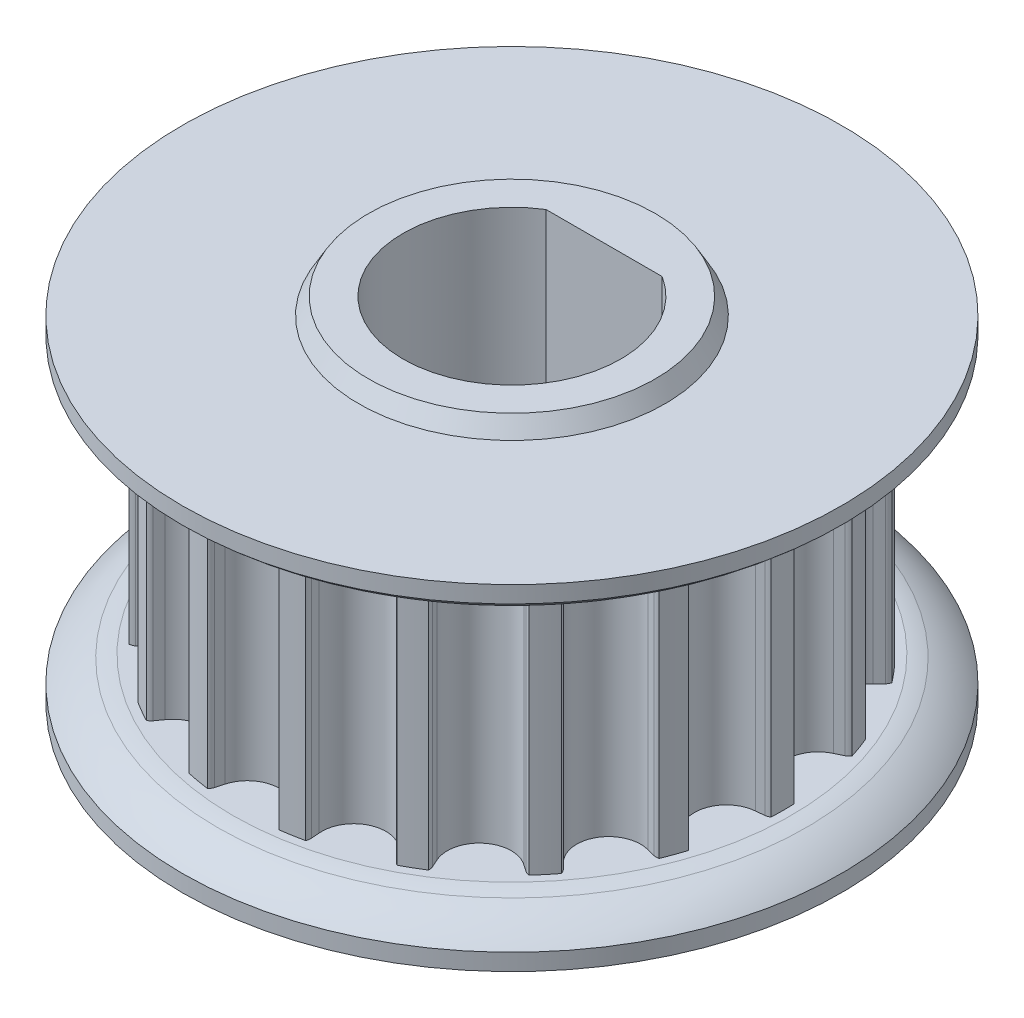
from build123d import *

# Parameters (mm, degrees)
SKETCH1_R           = 8.213367202
TOOTHOD_DEPTH       = 3.81
TOOTHPROFILE_DEPTH  = 13.224356899
TOOTHPATTERN_COUNT  = 18
SKETCH6_W           = 5.08
SKETCH6_H           = 0.508
BORE_DEPTH          = 16.194755053
BORE_DEPTH_BACK     = 16.194755053
SKETCH7_R           = 3.302
BOSS_EXTRUDE2_DEPTH = 7.747
CHAMFER1_SIZE       = 1.27
CHAMFER1_SIZE_2     = 0.733234842


with BuildPart() as part:
    # Sketch1 → ToothOD (new, symmetric)
    with BuildSketch(Plane(origin=(0, 0, 0), x_dir=(1, 0, 0), z_dir=(0, 1, 0))):
        with Locations(Location((0, 0, 0), (0, 0, 90))):
            Circle(SKETCH1_R)
    extrude(amount=TOOTHOD_DEPTH, both=True)

    # Sketch2 → ToothProfile (cut, symmetric)
    with BuildSketch(Plane(origin=(0, 0, 0), x_dir=(1, 0, 0), z_dir=(0, 1, 0))):
        with BuildLine():
            ThreePointArc((-0.937033068, 7.763429198), (-0.590385173, 7.245254588), (0, 7.044967202))
            ThreePointArc((0, 7.044967202), (0.590385173, 7.245254588), (0.937033068, 7.763429198))
            ThreePointArc((0.937033068, 7.763429198), (0.971699064, 7.88954066), (1.007805813, 8.015247202))
            ThreePointArc((1.007805813, 8.015247202), (1.037242296, 8.083128985), (1.082411127, 8.141731201))
            ThreePointArc((1.082411127, 8.141731201), (0, 8.213367202), (-1.082411127, 8.141731201))
            ThreePointArc((-1.082411127, 8.141731201), (-1.037242296, 8.083128985), (-1.007805813, 8.015247202))
            ThreePointArc((-1.007805813, 8.015247202), (-0.971699064, 7.88954066), (-0.937033068, 7.763429198))
        make_face()
    toothprofile = extrude(amount=TOOTHPROFILE_DEPTH, both=True, mode=Mode.SUBTRACT)

    # ToothPattern: ToothProfile ×18 about axis
    toothpattern_axis = Axis((0, 0, 0), (0, 1, 0))
    for i in range(1, TOOTHPATTERN_COUNT):
        add(toothprofile.rotate(toothpattern_axis, i * 360 / TOOTHPATTERN_COUNT), mode=Mode.SUBTRACT)

    # Sketch4 → Flange (revolve)
    with BuildSketch(Plane.XY, mode=Mode.PRIVATE) as flange_sk:
        with BuildLine():
            Line((0, -3.81), (8.467367202, -3.81))
            ThreePointArc((8.467367202, -3.81), (8.697013823, -3.845951298), (8.92243953, -3.902637424))
            ThreePointArc((8.92243953, -3.902637424), (9.490168107, -4.184197125), (9.991367202, -4.572))
            Line((9.991367202, -4.572), (9.991367202, -5.08))
            Line((9.991367202, -5.08), (0, -5.08))
            Line((0, -5.08), (0, -3.81))
        make_face()
        with BuildLine():
            Line((9.991367202, 5.08), (9.991367202, 4.572))
            ThreePointArc((9.991367202, 4.572), (9.490168107, 4.184197125), (8.92243953, 3.902637424))
            ThreePointArc((8.92243953, 3.902637424), (8.697013823, 3.845951298), (8.467367202, 3.81))
            Line((8.467367202, 3.81), (0, 3.81))
            Line((0, 3.81), (0, 5.08))
            Line((0, 5.08), (9.991367202, 5.08))
        make_face()
    revolve(flange_sk.sketch.rotate(Axis((0, 8.73125, 0), (0, -1, 0)), 90), axis=Axis((0, 8.73125, 0), (0, -1, 0)))

    # Sketch6 → TopBearingBoss (revolve)
    with BuildSketch(Plane.XY, mode=Mode.PRIVATE) as topbearingboss_sk:
        with Locations((2.54, 5.334)):
            Rectangle(SKETCH6_W, SKETCH6_H)
    topbearingboss = revolve(topbearingboss_sk.sketch.rotate(Axis((0, 8.73125, 0), (0, -1, 0)), 90), axis=Axis((0, 8.73125, 0), (0, -1, 0)))

    # BottomBearingBoss: TopBearingBoss across plane
    add(topbearingboss.mirror(Plane.ZX))

    # Sketch7 → Bore (cut, two sides: drawn at the far end of the back side and taken through both)
    with BuildSketch(Plane.XZ.offset(-BORE_DEPTH_BACK)):
        with Locations(Location((0, 0, 0), (0, 0, 270))):
            Circle(SKETCH7_R)
    extrude(amount=BORE_DEPTH + BORE_DEPTH_BACK, mode=Mode.SUBTRACT)

    # Sketch8 → Boss-Extrude2 (add)
    with BuildSketch(Plane(origin=(0, 5.588, 0), x_dir=(1, 0, 0), z_dir=(0, 1, 0))):
        with BuildLine():
            Line((-1.75976362, 2.794), (1.75976362, 2.794))
            ThreePointArc((1.75976362, 2.794), (0, 3.302), (-1.75976362, 2.794))
        make_face()
    extrude(amount=-BOSS_EXTRUDE2_DEPTH)

    # Chamfer1
    # the kernel refuses this chamfer: 1.27, 0.733234842 mm, written as the material it takes off along each edge
    with BuildSketch(Plane(origin=(0, 5.588, 0), x_dir=(0, 0, 1), z_dir=(1, 0, 0))) as chamfer1_piece_1_section:
        Polygon((5.08, CHAMFER1_SIZE), (5.08 - CHAMFER1_SIZE_2, 0), (5.08, 0), align=None)
    chamfer1_piece_1 = revolve(axis=Axis((0, 5.588, 0), (0, -1, 0)), mode=Mode.PRIVATE)
    chamfer1_piece_1 = split(chamfer1_piece_1, bisect_by=Plane(origin=(0, 5.08, -4.499394908), z_dir=(0, 1, 0)), keep=Keep.TOP, mode=Mode.PRIVATE)
    add(chamfer1_piece_1, mode=Mode.SUBTRACT)
    with BuildSketch(Plane(origin=(0, -5.588, 0), x_dir=(0, 0, 1), z_dir=(1, 0, 0))) as chamfer1_piece_2_section:
        Polygon((5.08 - CHAMFER1_SIZE, 0), (5.08, -CHAMFER1_SIZE_2), (5.08, 0), align=None)
    chamfer1_piece_2 = revolve(axis=Axis((0, -5.588, 0), (0, -1, 0)), mode=Mode.PRIVATE)
    chamfer1_piece_2 = split(chamfer1_piece_2, bisect_by=Plane(origin=(0, -5.08, -4.239907911), z_dir=(0, -1, 0)), keep=Keep.TOP, mode=Mode.PRIVATE)
    add(chamfer1_piece_2, mode=Mode.SUBTRACT)


solid = part.part
